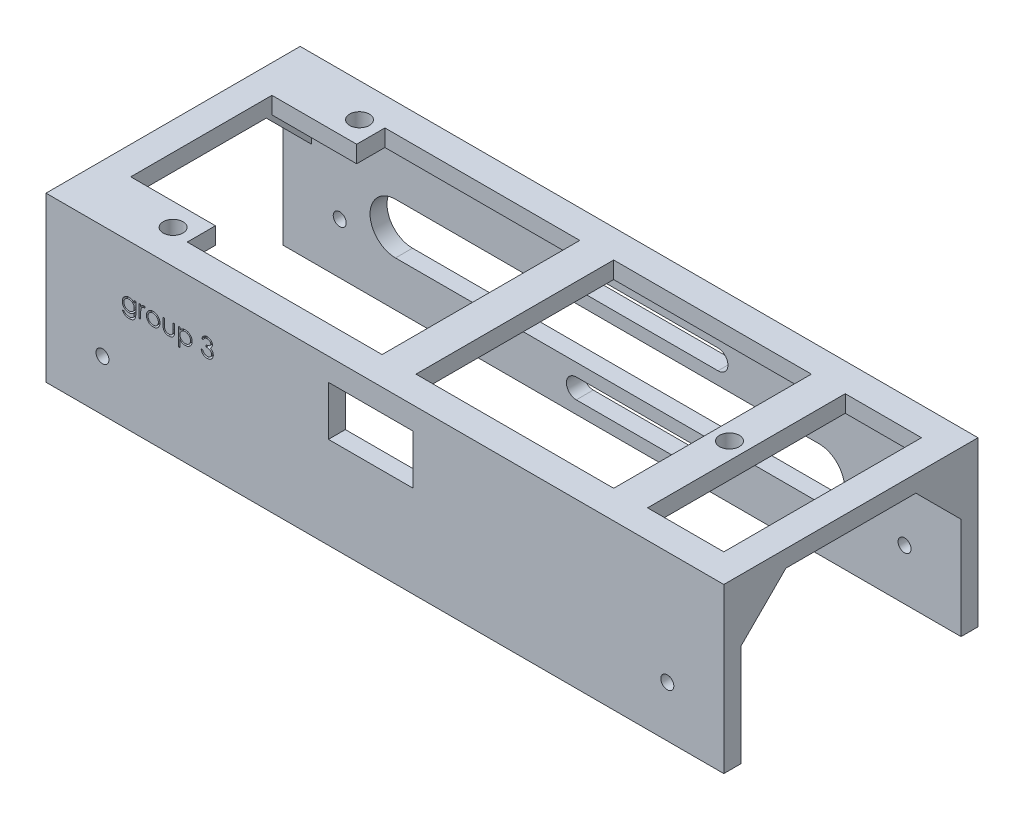
from build123d import *

# Parameters (mm, degrees)
SKETCH1_W           = 120
SKETCH1_H           = 29
BOSS_EXTRUDE5_DEPTH = 45
SHELL9_T            = -3
SKETCH3_R           = 1.15
CUT_EXTRUDE2_DEPTH  = 79
CUT_EXTRUDE8_DEPTH  = 23
SKETCH7_W           = 15
SKETCH7_H           = 8.75
CUT_EXTRUDE9_DEPTH  = 20
SKETCH13_W          = 110
SKETCH13_H          = 35
CUT_EXTRUDE14_DEPTH = 10
SKETCH17_W          = 15
SKETCH17_H          = 5
SKETCH17_W_2        = 6
SKETCH17_H_2        = 35
BOSS_EXTRUDE6_DEPTH = 3
SKETCH17_4_R        = 1.75
CUT_EXTRUDE16_DEPTH = 10
CUT_EXTRUDE15_DEPTH = 1.5
BOSS_EXTRUDE7_DEPTH = 5
BOSS_EXTRUDE8_DEPTH = 5


with BuildPart() as part:
    # Sketch1 → Boss-Extrude5 (new body)
    with BuildSketch(Plane.XY):
        with Locations((60, 14.5)):
            Rectangle(SKETCH1_W, SKETCH1_H)
    extrude(amount=BOSS_EXTRUDE5_DEPTH)

    # Shell9
    shell9_openings = [part.faces().sort_by_distance(p)[0] for p in [
        (120, 14.5, 22.5),
        (60, 0, 22.5),
        (0, 14.5, 22.5),
    ]]
    offset(amount=SHELL9_T, openings=shell9_openings, kind=Kind.INTERSECTION)

    # Sketch3 → Cut-Extrude2 (cut)
    with BuildSketch(Plane(origin=(0, 0, 0), x_dir=(-1, 0, 0), z_dir=(0, 0, -1))):
        with Locations((-10, 9)):
            Circle(SKETCH3_R)
        with Locations((-110, 9)):
            Circle(SKETCH3_R)
    extrude(amount=-CUT_EXTRUDE2_DEPTH, mode=Mode.SUBTRACT)

    # Sketch6 → Cut-Extrude8 (cut)
    with BuildSketch(Plane(origin=(0, 0, 0), x_dir=(-1, 0, 0), z_dir=(0, 0, -1))):
        with BuildLine():
            Line((-51.883496676, 22.75), (-76.973496676, 22.75))
            ThreePointArc((-76.973496676, 22.75), (-78.723496676, 21), (-76.973496676, 19.25))
            Line((-76.973496676, 19.25), (-51.883496676, 19.25))
            ThreePointArc((-51.883496676, 19.25), (-50.133496676, 21), (-51.883496676, 22.75))
        make_face()
        with BuildLine():
            Line((-19.873496676, 17), (-94.873496676, 17))
            ThreePointArc((-94.873496676, 17), (-99.373496676, 12.5), (-94.873496676, 8))
            Line((-94.873496676, 8), (-19.873496676, 8))
            ThreePointArc((-19.873496676, 8), (-15.373496676, 12.5), (-19.873496676, 17))
        make_face()
        with BuildLine():
            ThreePointArc((-76.973496676, 5.75), (-78.723496676, 4), (-76.973496676, 2.25))
            Line((-76.973496676, 2.25), (-51.883496676, 2.25))
            ThreePointArc((-51.883496676, 2.25), (-50.133496676, 4), (-51.883496676, 5.75))
            Line((-51.883496676, 5.75), (-76.973496676, 5.75))
        make_face()
    extrude(amount=-CUT_EXTRUDE8_DEPTH, mode=Mode.SUBTRACT)

    # Sketch7 → Cut-Extrude9 (cut)
    with BuildSketch(Plane.XY.offset(45)):
        with Locations((57.5, 20.625)):
            Rectangle(SKETCH7_W, SKETCH7_H)
    extrude(amount=-CUT_EXTRUDE9_DEPTH, mode=Mode.SUBTRACT)

    # Sketch13 → Cut-Extrude14 (cut)
    with BuildSketch(Plane(origin=(0, 29, 0), x_dir=(1, 0, 0), z_dir=(0, 1, 0))):
        with Locations((60, -22.5)):
            Rectangle(SKETCH13_W, SKETCH13_H)
    extrude(amount=-CUT_EXTRUDE14_DEPTH, mode=Mode.SUBTRACT)

    # Sketch17 → Boss-Extrude6 (add)
    with BuildSketch(Plane(origin=(0, 29, 0), x_dir=(1, 0, 0), z_dir=(0, 1, 0))):
        with Locations((12.5, -7.5)):
            Rectangle(SKETCH17_W, SKETCH17_H)
        with Locations((12.5, -37.5)):
            Rectangle(SKETCH17_W, SKETCH17_H)
        with Locations((57.5, -22.5)):
            Rectangle(SKETCH17_W_2, SKETCH17_H_2)
        with Locations((98.5, -22.5)):
            Rectangle(SKETCH17_W_2, SKETCH17_H_2)
    extrude(amount=-BOSS_EXTRUDE6_DEPTH)

    # Sketch17<4> → Cut-Extrude16 (cut)
    with BuildSketch(Plane(origin=(0, 29, 0), x_dir=(1, 0, 0), z_dir=(0, 1, 0))):
        with Locations((98.5, -22.5)):
            Circle(SKETCH17_4_R)
        with Locations((16.5, -6)):
            Circle(SKETCH17_4_R)
        with Locations((16.5, -39)):
            Circle(SKETCH17_4_R)
    extrude(amount=-CUT_EXTRUDE16_DEPTH, mode=Mode.SUBTRACT)

    # Sketch20 → Cut-Extrude15 (cut)
    # profile 1 of 6: a face of its own
    with BuildSketch(Plane.XY.offset(45)):
        with BuildLine():
            Line((15.616704574, 20.332761713), (15.901640472, 20.332761713))
            Line((15.901640472, 20.332761713), (15.901640472, 18.49149068))
            add(Edge.make_bspline(
                [(15.901640472, 18.49149068), (15.901389155, 18.452268005), (15.900904052, 18.376558794), (15.897410671, 18.267086354), (15.890044057, 18.165970691), (15.881690467, 18.072750642), (15.869673803, 17.9878583), (15.854999527, 17.91104035), (15.838457161, 17.842223075), (15.823924535, 17.799836969), (15.817050127, 17.779786954)],
                knots=[0, 0, 0, 0, 1.307562039, 2.523909702, 3.650326591, 4.686913197, 5.643429486, 6.506965704, 7.293745905, 8, 8, 8, 8], degree=3))
            add(Edge.make_bspline(
                [(15.817050127, 17.779786954), (15.806899889, 17.753724811), (15.786902899, 17.702379766), (15.749450931, 17.629595775), (15.707510176, 17.561064407), (15.659606909, 17.497167576), (15.605957751, 17.438226048), (15.547826683, 17.382959277), (15.484081581, 17.332536497), (15.414758892, 17.287827692), (15.341456639, 17.247562292), (15.264216961, 17.212685764), (15.183475406, 17.182308413), (15.098473497, 17.159554734), (15.010543928, 17.139838237), (14.918652687, 17.127006986), (14.823336649, 17.118273869), (14.758525483, 17.117466301), (14.725643877, 17.117056585)],
                knots=[0, 0, 0, 0, 0.981931301, 1.934503488, 2.87077864, 3.801706999, 4.735015492, 5.667491629, 6.616593066, 7.585388521, 8.561939025, 9.551802639, 10.560317337, 11.588439944, 12.640189604, 13.723962949, 14.845264515, 16, 16, 16, 16], degree=3))
            add(Edge.make_bspline(
                [(14.725643877, 17.117056585), (14.677669868, 17.11783354), (14.583963739, 17.119351142), (14.447343495, 17.137032186), (14.317590571, 17.162027939), (14.196419457, 17.19986072), (14.084595869, 17.246158561), (13.982883496, 17.299312554), (13.89219542, 17.360262855), (13.810440374, 17.429659829), (13.736651931, 17.512176883), (13.667230747, 17.609421549), (13.600409749, 17.722875084), (13.561249628, 17.806144188), (13.540743036, 17.849748893)],
                knots=[0, 0, 0, 0, 1.157897085, 2.2616841, 3.32207898, 4.345638746, 5.321241055, 6.241986252, 7.112515963, 7.955008012, 8.825025602, 9.77857164, 10.836726669, 12, 12, 12, 12], degree=3))
            Line((13.540743036, 17.849748893), (13.825678933, 17.849748893))
            add(Edge.make_bspline(
                [(13.825678933, 17.849748893), (13.848595366, 17.813367134), (13.89339417, 17.742245276), (13.977167435, 17.650158342), (14.068976031, 17.571460647), (14.171918315, 17.508041587), (14.286422618, 17.460226276), (14.412557826, 17.426140115), (14.55135034, 17.405732787), (14.647977577, 17.403273256), (14.698295119, 17.401992483)],
                knots=[0, 0, 0, 0, 0.997731894, 1.950442991, 2.880492273, 3.800895997, 4.748200782, 5.754801363, 6.83083817, 8, 8, 8, 8], degree=3))
            add(Edge.make_bspline(
                [(14.698295119, 17.401992483), (14.747976513, 17.403289832), (14.843757266, 17.405790991), (14.981489827, 17.426149222), (15.107215235, 17.460233694), (15.220209131, 17.507957016), (15.319138293, 17.566422742), (15.404420599, 17.631737095), (15.473494698, 17.705379862), (15.519952175, 17.773217644), (15.548830721, 17.833655247), (15.567220536, 17.885682245), (15.582164779, 17.944513069), (15.594665061, 18.009950487), (15.604980103, 18.08208799), (15.611514147, 18.161090521), (15.616236561, 18.246778529), (15.616544963, 18.306190162), (15.616704574, 18.336938396)],
                knots=[0, 0, 0, 0, 1.570740765, 3.028230971, 4.391408896, 5.680370741, 6.894727393, 8.017376726, 9.065722033, 10.075533815, 10.603371122, 11.180248986, 11.817768598, 12.521299649, 13.286540596, 14.121245857, 15.027658897, 16, 16, 16, 16], degree=3))
            Line((15.616704574, 18.336938396), (15.616704574, 18.457145728))
            add(Edge.make_bspline(
                [(15.616704574, 18.457145728), (15.587783846, 18.422727093), (15.530451097, 18.354495237), (15.431438879, 18.265085752), (15.323292106, 18.188081905), (15.206194892, 18.124927858), (15.083015558, 18.074416852), (14.955088249, 18.039090023), (14.823559742, 18.016266399), (14.734431006, 18.013810477), (14.689390872, 18.012569406)],
                knots=[0, 0, 0, 0, 1.012485704, 2.007162095, 2.997754123, 3.998611389, 4.999708251, 5.992315798, 6.98544096, 8, 8, 8, 8], degree=3))
            add(Edge.make_bspline(
                [(14.689390872, 18.012569406), (14.662869399, 18.013036608), (14.610140308, 18.013965485), (14.531804216, 18.022092376), (14.454624104, 18.033884092), (14.378779973, 18.051193683), (14.304162381, 18.073411178), (14.230894637, 18.101184934), (14.158383509, 18.132585791), (14.087947043, 18.169572548), (14.020286767, 18.210722641), (13.955913021, 18.255298635), (13.895162989, 18.303067225), (13.838614888, 18.354499449), (13.786342893, 18.409520868), (13.737643956, 18.467544948), (13.693323362, 18.52938192), (13.652471645, 18.593904232), (13.617040867, 18.661541641), (13.585940044, 18.730827485), (13.558898655, 18.801613615), (13.537340041, 18.874137022), (13.520874388, 18.948351984), (13.508618682, 19.02413692), (13.501667308, 19.1017252), (13.500583341, 19.153995995), (13.500037908, 19.180297771)],
                knots=[0, 0, 0, 0, 1.028754217, 2.045334182, 3.052854819, 4.056607503, 5.061168794, 6.071104265, 7.095078842, 8.125279047, 9.155117945, 10.165957491, 11.161587969, 12.151493252, 13.128948131, 14.104219989, 15.088194871, 16.07871515, 17.064853787, 18.047899887, 19.02414258, 20.002704429, 20.980574569, 21.971845993, 22.979467364, 24, 24, 24, 24], degree=3))
            add(Edge.make_bspline(
                [(13.500037908, 19.180297771), (13.500508866, 19.206607723), (13.501448958, 19.259125723), (13.509568775, 19.337030594), (13.521151346, 19.413892296), (13.53948268, 19.488918582), (13.561546682, 19.562963892), (13.588873066, 19.635481306), (13.621728655, 19.706492911), (13.658930356, 19.776051293), (13.700735212, 19.843223058), (13.746575391, 19.907019373), (13.796506234, 19.966970786), (13.8498389, 20.023682111), (13.907224591, 20.07660618), (13.96863362, 20.125614541), (14.033460661, 20.171528693), (14.101906631, 20.213358264), (14.172915405, 20.250353587), (14.24468294, 20.284110729), (14.31815991, 20.310902394), (14.391976428, 20.334509063), (14.467432493, 20.351232418), (14.543602915, 20.364134024), (14.620748464, 20.371994163), (14.672412876, 20.372975315), (14.698295119, 20.373466842)],
                knots=[0, 0, 0, 0, 1.008818848, 2.013730394, 3.001654427, 3.987803273, 4.973046549, 5.963777569, 6.957074694, 7.972068341, 8.987420212, 9.989399531, 10.982630087, 11.977756091, 12.973280677, 13.973972381, 14.989194003, 16.018387222, 17.047741039, 18.059210846, 19.057554164, 20.045176975, 21.029480261, 22.018708529, 23.007435371, 24, 24, 24, 24], degree=3))
            add(Edge.make_bspline(
                [(14.698295119, 20.373466842), (14.740977042, 20.372236145), (14.825260726, 20.369805898), (14.949295278, 20.350736716), (15.068985739, 20.320334718), (15.18500751, 20.276777682), (15.298305708, 20.217314433), (15.408506924, 20.138989044), (15.515929996, 20.04109895), (15.582222028, 19.966030281), (15.616704574, 19.926982467)],
                knots=[0, 0, 0, 0, 0.96728863, 1.910097829, 2.838038873, 3.762875196, 4.71315279, 5.730631239, 6.819562287, 8, 8, 8, 8], degree=3))
            Line((15.616704574, 19.926982467), (15.616704574, 20.332761713))
        make_face()
        with BuildLine():
            add(Edge.make_bspline(
                [(14.721191754, 20.088530944), (14.679526044, 20.087114835), (14.597036773, 20.084311238), (14.476125205, 20.060376534), (14.359396844, 20.022869897), (14.249083349, 19.969219095), (14.145753328, 19.903819322), (14.054064026, 19.824589204), (13.973868138, 19.734105154), (13.90602933, 19.633185287), (13.852025876, 19.524307938), (13.813795774, 19.409544629), (13.78907611, 19.290749742), (13.78634774, 19.209676024), (13.784973805, 19.168849454)],
                knots=[0, 0, 0, 0, 1.026226791, 2.031711442, 3.026614839, 4.04107745, 5.047145931, 6.032893242, 7.017642609, 8.019221815, 9.021877557, 10.003543541, 10.994637589, 12, 12, 12, 12], degree=3))
            add(Edge.make_bspline(
                [(13.784973805, 19.168849454), (13.78563217, 19.138067128), (13.786926982, 19.077527295), (13.799376227, 18.988683633), (13.819497532, 18.904065063), (13.848015569, 18.823666466), (13.883351228, 18.747026688), (13.927794307, 18.674673668), (13.980091974, 18.60654297), (14.039834895, 18.543138509), (14.105672041, 18.485388916), (14.177081601, 18.434645122), (14.25396672, 18.393142682), (14.334436469, 18.357273494), (14.42044337, 18.331076054), (14.510748612, 18.311083733), (14.605991079, 18.299645788), (14.670916871, 18.298228108), (14.704019278, 18.297505303)],
                knots=[0, 0, 0, 0, 1.039728707, 2.044842319, 3.024901384, 3.974314358, 4.923051295, 5.871625912, 6.837440708, 7.820715446, 8.810779094, 9.792721783, 10.773906224, 11.758876063, 12.764959493, 13.806266761, 14.881525401, 16, 16, 16, 16], degree=3))
            add(Edge.make_bspline(
                [(14.704019278, 18.297505303), (14.737550687, 18.298201634), (14.803121003, 18.299563302), (14.898888923, 18.311268619), (14.989632909, 18.330157126), (15.075269755, 18.356975013), (15.1561228, 18.39119403), (15.231283772, 18.434497961), (15.302364264, 18.483814268), (15.367094722, 18.541338023), (15.425627358, 18.604733697), (15.476636696, 18.673717281), (15.520101946, 18.747250752), (15.556095261, 18.825325821), (15.583573711, 18.908549241), (15.60200586, 18.996712964), (15.614893407, 19.089394606), (15.616091675, 19.152902422), (15.616704574, 19.185385912)],
                knots=[0, 0, 0, 0, 1.121943988, 2.193949579, 3.223793937, 4.220241907, 5.192961521, 6.155822191, 7.11847367, 8.083710714, 9.04790392, 10.001595906, 10.949595423, 11.902125208, 12.873731292, 13.87582262, 14.913508608, 16, 16, 16, 16], degree=3))
            add(Edge.make_bspline(
                [(15.616704574, 19.185385912), (15.615489395, 19.227674965), (15.613115361, 19.310292915), (15.59071151, 19.430676912), (15.554588891, 19.543859923), (15.503927909, 19.649483987), (15.440444229, 19.746429935), (15.363980388, 19.83290228), (15.27585506, 19.909012343), (15.176321441, 19.97241999), (15.069235544, 20.023642205), (14.957184173, 20.062070384), (14.840333683, 20.083836656), (14.761134297, 20.086957176), (14.721191754, 20.088530944)],
                knots=[0, 0, 0, 0, 1.070913519, 2.092188694, 3.091357305, 4.074328408, 5.051968682, 6.018948707, 6.99050112, 7.9935919, 9.000589572, 9.992915277, 10.987769056, 12, 12, 12, 12], degree=3))
        make_face(mode=Mode.SUBTRACT)
    # profile 2 of 6: a face of its own
    with BuildSketch(Plane.XY.offset(45)):
        with BuildLine():
            Line((16.471512267, 20.332761713), (16.756448164, 20.332761713))
            Line((16.756448164, 20.332761713), (16.756448164, 19.991220247))
            add(Edge.make_bspline(
                [(16.756448164, 19.991220247), (16.777483681, 20.023020891), (16.817713944, 20.083839376), (16.884582101, 20.1642751), (16.953074409, 20.230873035), (17.023518757, 20.283944084), (17.096433176, 20.323688842), (17.170217411, 20.352801809), (17.246032302, 20.370016945), (17.29697919, 20.372315336), (17.322503853, 20.373466842)],
                knots=[0, 0, 0, 0, 1.2804753, 2.448899062, 3.506932113, 4.484331642, 5.4025378, 6.288909075, 7.142734305, 8, 8, 8, 8], degree=3))
            add(Edge.make_bspline(
                [(17.322503853, 20.373466842), (17.342303449, 20.372386864), (17.383042405, 20.37016474), (17.444712326, 20.354552063), (17.508251743, 20.329625571), (17.549202337, 20.306184798), (17.570550728, 20.293964638)],
                knots=[0, 0, 0, 0, 0.901110191, 1.854092781, 2.881294221, 4, 4, 4, 4], degree=3))
            Line((17.570550728, 20.293964638), (17.414090392, 20.047189798))
            add(Edge.make_bspline(
                [(17.414090392, 20.047189798), (17.400384351, 20.053304183), (17.374367662, 20.064910455), (17.336308877, 20.078646421), (17.301219379, 20.08673443), (17.278864151, 20.087959724), (17.268442355, 20.088530944)],
                knots=[0, 0, 0, 0, 1.180555205, 2.24091978, 3.179933427, 4, 4, 4, 4], degree=3))
            add(Edge.make_bspline(
                [(17.268442355, 20.088530944), (17.245577154, 20.08700691), (17.198938771, 20.083898323), (17.130463547, 20.059460976), (17.064017868, 20.019977365), (17.01124786, 19.976188571), (16.970388102, 19.933963069), (16.941232326, 19.897089161), (16.914487262, 19.855742831), (16.888932848, 19.810630903), (16.865649853, 19.760983115), (16.843919546, 19.707295485), (16.824271863, 19.649505833), (16.813068427, 19.609244546), (16.807329574, 19.588621088)],
                knots=[0, 0, 0, 0, 1.125678352, 2.296057538, 3.5422874, 4.923748041, 5.663163013, 6.437101912, 7.23742474, 8.08941207, 8.991984279, 9.93940061, 10.944477711, 12, 12, 12, 12], degree=3))
            add(Edge.make_bspline(
                [(16.807329574, 19.588621088), (16.803036618, 19.570226795), (16.793528044, 19.529484834), (16.784282864, 19.461132958), (16.775148372, 19.380375782), (16.768710726, 19.286988515), (16.762743502, 19.18120437), (16.759377927, 19.06286219), (16.756562935, 18.931840507), (16.756487582, 18.840242344), (16.756448164, 18.792327018)],
                knots=[0, 0, 0, 0, 0.566838948, 1.255505196, 2.06880316, 3.007127437, 4.065329342, 5.249902469, 6.561414163, 8, 8, 8, 8], degree=3))
            Line((16.756448164, 18.792327018), (16.756448164, 18.012569406))
            Line((16.756448164, 18.012569406), (16.471512267, 18.012569406))
            Line((16.471512267, 18.012569406), (16.471512267, 20.332761713))
        make_face()
    # profile 3 of 6: a face of its own
    with BuildSketch(Plane.XY.offset(45)):
        with BuildLine():
            add(Edge.make_bspline(
                [(18.976149687, 20.373466842), (19.019684627, 20.37253984), (19.105046006, 20.370722218), (19.230057445, 20.351295784), (19.349387675, 20.321589247), (19.463493721, 20.280521473), (19.570914218, 20.225474275), (19.673213846, 20.159788703), (19.770112133, 20.081971636), (19.828190167, 20.021775389), (19.857670119, 19.991220247)],
                knots=[0, 0, 0, 0, 1.054011418, 2.066658804, 3.057071809, 4.030435133, 4.997543892, 5.974964718, 6.972108034, 8, 8, 8, 8], degree=3))
            add(Edge.make_bspline(
                [(19.857670119, 19.991220247), (19.883053749, 19.96199756), (19.933329765, 19.904117725), (19.997796525, 19.810268705), (20.053333226, 19.713077328), (20.09784034, 19.611252967), (20.132933183, 19.505684516), (20.157848493, 19.39600912), (20.172668427, 19.282468991), (20.174666833, 19.205358366), (20.175678933, 19.166305383)],
                knots=[0, 0, 0, 0, 1.025258237, 2.030674902, 3.01204498, 3.988269485, 4.97094183, 5.956517959, 6.965070386, 8, 8, 8, 8], degree=3))
            add(Edge.make_bspline(
                [(20.175678933, 19.166305383), (20.17478872, 19.127026045), (20.173029618, 19.049408242), (20.156389337, 18.935090674), (20.130507566, 18.824242513), (20.093467256, 18.717327841), (20.045970971, 18.614019848), (19.98801299, 18.514769757), (19.919186595, 18.41938175), (19.841168683, 18.328665797), (19.754943053, 18.245057873), (19.661401975, 18.172188657), (19.562383673, 18.109757703), (19.456571489, 18.059468955), (19.344931697, 18.019818012), (19.227223499, 17.991968712), (19.103629757, 17.975130613), (19.019240778, 17.972968371), (18.976149687, 17.971864278)],
                knots=[0, 0, 0, 0, 0.998656419, 1.973391657, 2.932242238, 3.890759089, 4.846373663, 5.82037756, 6.809684879, 7.83454468, 8.860553229, 9.859544525, 10.845671541, 11.83227036, 12.833544569, 13.85385346, 14.904124723, 16, 16, 16, 16], degree=3))
            add(Edge.make_bspline(
                [(18.976149687, 17.971864278), (18.932847477, 17.972972077), (18.848037911, 17.975141758), (18.724007913, 17.991903293), (18.606088759, 18.019805177), (18.494302816, 18.05959926), (18.388035705, 18.10975931), (18.288443668, 18.171999915), (18.194826602, 18.245079484), (18.10858273, 18.328659941), (18.03056971, 18.419383259), (17.961742052, 18.514769365), (17.903784399, 18.61401995), (17.856288029, 18.717327814), (17.819247741, 18.824242521), (17.793365964, 18.935090672), (17.776725685, 19.049408242), (17.774966583, 19.127026045), (17.774076369, 19.166305383)],
                knots=[0, 0, 0, 0, 1.099876186, 2.154163076, 3.173186993, 4.173200201, 5.163417411, 6.152872554, 7.150605724, 8.17532212, 9.198891216, 10.186952605, 11.159729845, 12.11414092, 13.071450619, 14.029093627, 15.002601286, 16, 16, 16, 16], degree=3))
            add(Edge.make_bspline(
                [(17.774076369, 19.166305383), (17.775095372, 19.205146107), (17.777112823, 19.282044065), (17.791917856, 19.395370756), (17.816735975, 19.50486053), (17.851870885, 19.610021498), (17.896788237, 19.711399643), (17.951544548, 19.808831168), (18.016668907, 19.902255816), (18.066744963, 19.960060846), (18.092085183, 19.989312194)],
                knots=[0, 0, 0, 0, 1.031353054, 2.041901799, 3.029428768, 4.008703097, 4.981709435, 5.96992636, 6.972712378, 8, 8, 8, 8], degree=3))
            add(Edge.make_bspline(
                [(18.092085183, 19.989312194), (18.121520691, 20.020132318), (18.179410796, 20.080745514), (18.276791428, 20.158335732), (18.378839394, 20.22538817), (18.487447005, 20.279341594), (18.601459312, 20.321830821), (18.721401054, 20.351372396), (18.8468367, 20.370652225), (18.932615785, 20.372519286), (18.976149687, 20.373466842)],
                knots=[0, 0, 0, 0, 1.027980169, 2.021703884, 2.998553061, 3.971491411, 4.943284454, 5.930300938, 6.949603206, 8, 8, 8, 8], degree=3))
        make_face()
        with BuildLine():
            add(Edge.make_bspline(
                [(18.974877651, 20.088530944), (18.94409139, 20.087655922), (18.883313609, 20.085928465), (18.793851557, 20.072789495), (18.707727274, 20.05197283), (18.624777366, 20.022396294), (18.545281559, 19.984206578), (18.469163744, 19.937299709), (18.396200031, 19.882296955), (18.327817731, 19.819284389), (18.26505949, 19.750451301), (18.210197326, 19.67711029), (18.163547408, 19.600450961), (18.124685264, 19.520393598), (18.095740886, 19.436126908), (18.074719644, 19.348605193), (18.061593069, 19.257650137), (18.059881854, 19.195818356), (18.059012267, 19.16439733)],
                knots=[0, 0, 0, 0, 1.021534396, 2.016698045, 2.994645724, 3.958388632, 4.93408049, 5.916473867, 6.921342795, 7.962252576, 8.998418191, 10.008913653, 10.997312074, 11.973003931, 12.956656626, 13.948281152, 14.957379055, 16, 16, 16, 16], degree=3))
            add(Edge.make_bspline(
                [(18.059012267, 19.16439733), (18.060469885, 19.123800849), (18.063362986, 19.043224424), (18.08688995, 18.924560048), (18.126247504, 18.810639368), (18.179394536, 18.702130218), (18.245984463, 18.601734651), (18.324440588, 18.512225519), (18.413920888, 18.434949819), (18.513358713, 18.370832194), (18.620722987, 18.319887273), (18.734348364, 18.283783917), (18.852858136, 18.260314596), (18.933848514, 18.257981901), (18.974877651, 18.256800175)],
                knots=[0, 0, 0, 0, 1.016792936, 2.018143844, 3.017858371, 4.030088057, 5.03801393, 6.028138512, 7.003788237, 7.991172063, 8.984598303, 9.972568034, 10.972917682, 12, 12, 12, 12], degree=3))
            add(Edge.make_bspline(
                [(18.974877651, 18.256800175), (19.015904429, 18.257988786), (19.096890148, 18.260335072), (19.215235258, 18.283665716), (19.328550076, 18.320045465), (19.435802834, 18.370774898), (19.535195396, 18.435193303), (19.625319242, 18.51178916), (19.703105482, 18.601971725), (19.769629538, 18.702263197), (19.82364694, 18.810471145), (19.862820273, 18.924581074), (19.886403798, 19.043219069), (19.889289264, 19.123799055), (19.890743036, 19.16439733)],
                knots=[0, 0, 0, 0, 1.02726834, 2.027799167, 3.010890988, 4.004497153, 4.992059811, 5.971914811, 6.958719428, 7.966827853, 8.981595046, 9.981490638, 10.983022906, 12, 12, 12, 12], degree=3))
            add(Edge.make_bspline(
                [(19.890743036, 19.16439733), (19.889873748, 19.195818544), (19.888163122, 19.257650694), (19.875032262, 19.348603063), (19.854026879, 19.436134725), (19.825024055, 19.520364757), (19.786330771, 19.600658243), (19.738781252, 19.67688521), (19.684143107, 19.750705362), (19.620627576, 19.819061879), (19.552316655, 19.882321519), (19.47932337, 19.937321037), (19.403318425, 19.984000427), (19.324053568, 20.022722945), (19.241093025, 20.051703747), (19.155089415, 20.072909691), (19.066009066, 20.085872941), (19.005449077, 20.087639276), (18.974877651, 20.088530944)],
                knots=[0, 0, 0, 0, 1.042956736, 2.052379634, 3.044323526, 4.02829302, 5.004299113, 5.996692471, 7.007513377, 8.048758398, 9.090003419, 10.095195979, 11.07790575, 12.047570684, 13.018257071, 13.989683339, 14.985167495, 16, 16, 16, 16], degree=3))
        make_face(mode=Mode.SUBTRACT)
    # profile 4 of 6: a face of its own
    with BuildSketch(Plane.XY.offset(45)):
        with BuildLine():
            Line((20.7048456, 20.332761713), (20.989781497, 20.332761713))
            Line((20.989781497, 20.332761713), (20.989781497, 19.256619887))
            add(Edge.make_bspline(
                [(20.989781497, 19.256619887), (20.989910225, 19.225030678), (20.990156476, 19.164602003), (20.991826473, 19.077647655), (20.995754486, 18.998348208), (21.000665598, 18.926657854), (21.00698125, 18.86258872), (21.014495442, 18.806364589), (21.022894153, 18.757347865), (21.031115329, 18.727826393), (21.034938749, 18.71409685)],
                knots=[0, 0, 0, 0, 1.388932606, 2.656963016, 3.823490214, 4.879454478, 5.816252168, 6.653371382, 7.373723809, 8, 8, 8, 8], degree=3))
            add(Edge.make_bspline(
                [(21.034938749, 18.71409685), (21.041072355, 18.696840388), (21.05321205, 18.662686223), (21.075231567, 18.613347625), (21.102471558, 18.567650048), (21.132280116, 18.523831353), (21.166660293, 18.483189551), (21.205177099, 18.445793272), (21.246541214, 18.410229561), (21.3080047, 18.368151928), (21.392059891, 18.323053022), (21.502416319, 18.284140387), (21.622072295, 18.260885035), (21.704771719, 18.258186961), (21.747278493, 18.256800175)],
                knots=[0, 0, 0, 0, 0.725840625, 1.436591201, 2.137033971, 2.831655856, 3.53531722, 4.242432219, 4.957935707, 5.694543706, 7.190802206, 8.724350549, 10.316345118, 12, 12, 12, 12], degree=3))
            add(Edge.make_bspline(
                [(21.747278493, 18.256800175), (21.789781318, 18.258216451), (21.872016419, 18.260956682), (21.990357713, 18.283438892), (22.098535782, 18.320999767), (22.195464859, 18.373439347), (22.2807053, 18.437612504), (22.351738594, 18.512913352), (22.410346603, 18.596959582), (22.435936578, 18.659665178), (22.448805937, 18.691200215)],
                knots=[0, 0, 0, 0, 1.157059328, 2.238695713, 3.266970494, 4.264342957, 5.228770407, 6.160125903, 7.074715775, 8, 8, 8, 8], degree=3))
            add(Edge.make_bspline(
                [(22.448805937, 18.691200215), (22.452610702, 18.703869643), (22.46102211, 18.731878654), (22.470059386, 18.779394569), (22.478200505, 18.836058889), (22.485152101, 18.902242407), (22.490109784, 18.977772166), (22.492782251, 19.062624564), (22.495801472, 19.156533227), (22.495847297, 19.222271837), (22.495871241, 19.256619887)],
                knots=[0, 0, 0, 0, 0.557542046, 1.232589297, 2.036731608, 2.971723315, 4.038036528, 5.22795436, 6.551621927, 8, 8, 8, 8], degree=3))
            Line((22.495871241, 19.256619887), (22.495871241, 20.332761713))
            Line((22.495871241, 20.332761713), (22.780807138, 20.332761713))
            Line((22.780807138, 20.332761713), (22.780807138, 19.203194406))
            add(Edge.make_bspline(
                [(22.780807138, 19.203194406), (22.780406458, 19.164815757), (22.779629084, 19.09035593), (22.774633136, 18.9821482), (22.766060988, 18.881308163), (22.753050123, 18.787782443), (22.737750547, 18.701642441), (22.7180145, 18.622777758), (22.694448527, 18.551431377), (22.667864238, 18.486351337), (22.636457258, 18.427344511), (22.60304989, 18.371341306), (22.564473847, 18.319731286), (22.523860848, 18.269945348), (22.478683632, 18.224459819), (22.42978876, 18.18223098), (22.377864429, 18.142613302), (22.321758371, 18.107151927), (22.262289657, 18.075205398), (22.199384872, 18.046887956), (22.132273538, 18.02447919), (22.061821525, 18.005147372), (21.98768366, 17.98998496), (21.909931418, 17.97929286), (21.828590988, 17.972738453), (21.773155978, 17.972160562), (21.744734422, 17.971864278)],
                knots=[0, 0, 0, 0, 1.493040784, 2.896703357, 4.213163133, 5.428574705, 6.569057535, 7.615249723, 8.588095153, 9.490268104, 10.346124644, 11.18633936, 12.024365274, 12.850166724, 13.684164916, 14.514361689, 15.362232829, 16.222528818, 17.093394965, 17.986930858, 18.902426812, 19.842810585, 20.827885679, 21.843828298, 22.894529745, 24, 24, 24, 24], degree=3))
            add(Edge.make_bspline(
                [(21.744734422, 17.971864278), (21.716525441, 17.97217244), (21.661092168, 17.972778009), (21.57974754, 17.979256649), (21.501779875, 17.989968347), (21.427466371, 18.005258437), (21.356732454, 18.024343879), (21.289291607, 18.047025657), (21.225933518, 18.075220094), (21.165896986, 18.106949736), (21.109651962, 18.142841093), (21.056939181, 18.1821821), (21.007829322, 18.224914029), (20.962311553, 18.270858417), (20.921024781, 18.320585209), (20.883454515, 18.373694396), (20.849022361, 18.429659748), (20.817859472, 18.489588474), (20.791088094, 18.555421654), (20.767452264, 18.628262592), (20.748120471, 18.708909875), (20.732388374, 18.797294553), (20.719732425, 18.892993627), (20.71094571, 18.996560689), (20.706032778, 19.107743467), (20.705249858, 19.18453301), (20.7048456, 19.224182988)],
                knots=[0, 0, 0, 0, 1.083640291, 2.129454052, 3.13281866, 4.105697902, 5.042300162, 5.946461698, 6.836384745, 7.703652036, 8.553297018, 9.397182691, 10.228592656, 11.052265423, 11.879314572, 12.708807002, 13.549817954, 14.402308542, 15.300838682, 16.27712199, 17.341985831, 18.484375296, 19.725102775, 21.0496083, 22.476576903, 24, 24, 24, 24], degree=3))
            Line((20.7048456, 19.224182988), (20.7048456, 20.332761713))
        make_face()
    # profile 5 of 6: a face of its own
    with BuildSketch(Plane.XY.offset(45)):
        with BuildLine():
            Line((23.43208919, 20.332761713), (23.717025087, 20.332761713))
            Line((23.717025087, 20.332761713), (23.717025087, 19.903449814))
            add(Edge.make_bspline(
                [(23.717025087, 19.903449814), (23.747285091, 19.942400473), (23.806089351, 20.018093283), (23.907439801, 20.116055757), (24.014416263, 20.198674068), (24.129771645, 20.263428223), (24.251713135, 20.312251388), (24.379740309, 20.348337032), (24.51493976, 20.369601798), (24.607374399, 20.372161448), (24.654515071, 20.373466842)],
                knots=[0, 0, 0, 0, 1.0828784, 2.104357462, 3.088488658, 4.04616522, 5.001424249, 5.969181776, 6.964304535, 8, 8, 8, 8], degree=3))
            add(Edge.make_bspline(
                [(24.654515071, 20.373466842), (24.69569174, 20.372275601), (24.777079588, 20.369921051), (24.896879803, 20.35397978), (25.012246044, 20.32665873), (25.122525636, 20.2872879), (25.228899988, 20.238614724), (25.329794321, 20.177185698), (25.42678019, 20.106060082), (25.517418447, 20.024206631), (25.601167116, 19.935643847), (25.673599009, 19.840373614), (25.736075665, 19.741528982), (25.786576577, 19.637577584), (25.826135578, 19.529337997), (25.854270321, 19.416372911), (25.87101404, 19.299101165), (25.873260536, 19.21936084), (25.874396882, 19.179025736)],
                knots=[0, 0, 0, 0, 1.041296284, 2.058176809, 3.050446431, 4.034000596, 5.01514041, 6.003636468, 7.015969324, 8.052561599, 9.08815499, 10.094063707, 11.074456064, 12.040834395, 13.011057502, 13.983766392, 14.980127149, 16, 16, 16, 16], degree=3))
            add(Edge.make_bspline(
                [(25.874396882, 19.179025736), (25.873285192, 19.137839356), (25.871092778, 19.056613871), (25.854088379, 18.93733629), (25.826913215, 18.822594172), (25.787853292, 18.712578369), (25.737378513, 18.607364628), (25.675960805, 18.507028826), (25.603492367, 18.41160311), (25.520669201, 18.322382979), (25.430814037, 18.240196459), (25.334768029, 18.16831621), (25.234021718, 18.107953677), (25.129090538, 18.057531992), (25.019076209, 18.019529797), (24.904492021, 17.992117935), (24.785400359, 17.975213785), (24.704391457, 17.972989342), (24.663419318, 17.971864278)],
                knots=[0, 0, 0, 0, 1.038740735, 2.04854663, 3.033179607, 4.009277356, 4.987731542, 5.972001279, 6.972200261, 8.005528982, 9.039189865, 10.040446548, 11.026516639, 11.997840187, 12.972163198, 13.956796175, 14.96660207, 16, 16, 16, 16], degree=3))
            add(Edge.make_bspline(
                [(24.663419318, 17.971864278), (24.617311449, 17.973038853), (24.52623489, 17.975358984), (24.393068432, 17.998871592), (24.264910145, 18.034011526), (24.143179897, 18.085445614), (24.026913381, 18.150991689), (23.916768272, 18.230920233), (23.812159503, 18.325064085), (23.749195845, 18.39648509), (23.717025087, 18.432977058)],
                knots=[0, 0, 0, 0, 1.014726462, 2.004382257, 2.969841629, 3.936926163, 4.907207904, 5.903978561, 6.929055279, 8, 8, 8, 8], degree=3))
            Line((23.717025087, 18.432977058), (23.717025087, 17.157761713))
            Line((23.717025087, 17.157761713), (23.43208919, 17.157761713))
            Line((23.43208919, 17.157761713), (23.43208919, 20.332761713))
        make_face()
        with BuildLine():
            add(Edge.make_bspline(
                [(24.651971001, 20.088530944), (24.619695255, 20.087950139), (24.55615263, 20.086806682), (24.46301426, 20.073223171), (24.373301979, 20.053503935), (24.287919923, 20.023648139), (24.206049721, 19.987000645), (24.128321943, 19.941206249), (24.05479115, 19.887093358), (23.985642343, 19.825698524), (23.923173499, 19.758048629), (23.867871414, 19.685851116), (23.821419073, 19.609197418), (23.782863669, 19.528801553), (23.753523691, 19.44403333), (23.732699574, 19.355375526), (23.719609182, 19.262731101), (23.717895646, 19.199633867), (23.717025087, 19.167577419)],
                knots=[0, 0, 0, 0, 1.05670511, 2.080379991, 3.077984906, 4.06214886, 5.038337365, 6.01289324, 7.01187578, 8.025460281, 9.038092164, 10.024533457, 11.000252242, 11.969694649, 12.940728589, 13.933144304, 14.949937299, 16, 16, 16, 16], degree=3))
            add(Edge.make_bspline(
                [(23.717025087, 19.167577419), (23.718468221, 19.125496774), (23.721295442, 19.043057226), (23.744280055, 18.922603059), (23.78168633, 18.808619057), (23.834780234, 18.702065116), (23.901861248, 18.604109258), (23.982686004, 18.516397065), (24.076523176, 18.439479886), (24.181812699, 18.374690606), (24.294681347, 18.322087146), (24.41241571, 18.284427827), (24.533396709, 18.261230162), (24.615192256, 18.258284834), (24.656423124, 18.256800175)],
                knots=[0, 0, 0, 0, 1.03728447, 2.032128127, 3.01272805, 3.987917167, 4.958271349, 5.931593992, 6.91984656, 7.941419022, 8.973179163, 9.983609215, 10.983593296, 12, 12, 12, 12], degree=3))
            add(Edge.make_bspline(
                [(24.656423124, 18.256800175), (24.696823428, 18.258212031), (24.777010768, 18.261014312), (24.895082778, 18.285269668), (25.009827857, 18.32232194), (25.118848442, 18.376350966), (25.221195463, 18.442563376), (25.313616587, 18.521992835), (25.394358573, 18.614058712), (25.463178381, 18.716573568), (25.518633371, 18.826496952), (25.56029866, 18.940235783), (25.584345723, 19.057389131), (25.587753667, 19.136308485), (25.589460985, 19.175845648)],
                knots=[0, 0, 0, 0, 1.00104056, 1.986885549, 2.97790532, 3.984399681, 4.995088187, 5.994304198, 6.996462723, 8.023150851, 9.048424203, 10.043036403, 11.019596776, 12, 12, 12, 12], degree=3))
            add(Edge.make_bspline(
                [(25.589460985, 19.175845648), (25.588141333, 19.215628388), (25.585512312, 19.294883921), (25.55961607, 19.411690268), (25.520699662, 19.525888647), (25.463949665, 19.63431086), (25.396638513, 19.736613063), (25.315225166, 19.826922653), (25.223951902, 19.905998906), (25.121726732, 19.971327171), (25.012016489, 20.023293299), (24.896523672, 20.061287742), (24.775834119, 20.08412393), (24.693621889, 20.087049017), (24.651971001, 20.088530944)],
                knots=[0, 0, 0, 0, 0.983928682, 1.960191568, 2.949917689, 3.96440592, 4.982380491, 5.975291189, 6.965713506, 7.964880129, 8.970154049, 9.96478489, 10.968906225, 12, 12, 12, 12], degree=3))
        make_face(mode=Mode.SUBTRACT)
    # profile 6 of 6: a face of its own
    with BuildSketch(Plane.XY.offset(45)):
        with BuildLine():
            Line((27.868948164, 20.454877098), (27.584012267, 20.454877098))
            add(Edge.make_bspline(
                [(27.584012267, 20.454877098), (27.591731645, 20.486837994), (27.606822398, 20.549318932), (27.638298054, 20.638588376), (27.672587378, 20.723064713), (27.71376178, 20.801166151), (27.758673293, 20.874462299), (27.810128904, 20.941290719), (27.865754653, 21.003351052), (27.927281571, 21.058426632), (27.991805428, 21.108299286), (28.060235405, 21.150821659), (28.131194744, 21.187401427), (28.205175086, 21.217536923), (28.282396685, 21.240238648), (28.362161414, 21.256709464), (28.444678304, 21.267405689), (28.50069219, 21.268449596), (28.529134462, 21.268979662)],
                knots=[0, 0, 0, 0, 1.162005537, 2.271625781, 3.343758855, 4.383309926, 5.390229558, 6.379919256, 7.361854164, 8.333198761, 9.295911338, 10.242430842, 11.177959212, 12.116337295, 13.062827104, 14.020064771, 14.994644689, 16, 16, 16, 16], degree=3))
            add(Edge.make_bspline(
                [(28.529134462, 21.268979662), (28.570575235, 21.267728503), (28.652552838, 21.265253477), (28.772987888, 21.242652524), (28.889126502, 21.206888297), (28.999697463, 21.157472844), (29.102402755, 21.096524353), (29.193784868, 21.023984913), (29.27260516, 20.941254118), (29.338730774, 20.849875292), (29.390505951, 20.752216366), (29.428684304, 20.651704794), (29.451926829, 20.548579006), (29.454939049, 20.478949189), (29.456448164, 20.444064798)],
                knots=[0, 0, 0, 0, 1.083050992, 2.142477498, 3.193116406, 4.255571735, 5.30263384, 6.308962982, 7.297363603, 8.282367274, 9.249857812, 10.179914175, 11.08814088, 12, 12, 12, 12], degree=3))
            add(Edge.make_bspline(
                [(29.456448164, 20.444064798), (29.455392621, 20.410494349), (29.453327086, 20.344802189), (29.435788653, 20.248897688), (29.406273615, 20.158508522), (29.365388902, 20.073254182), (29.312464781, 19.99367522), (29.248354549, 19.919592591), (29.172605706, 19.850677711), (29.115202669, 19.811199332), (29.085649887, 19.790874694)],
                knots=[0, 0, 0, 0, 1.024540389, 2.004866551, 2.965041327, 3.920577974, 4.882998113, 5.874504559, 6.905732034, 8, 8, 8, 8], degree=3))
            add(Edge.make_bspline(
                [(29.085649887, 19.790874694), (29.119424407, 19.774565924), (29.1863415, 19.742253534), (29.277555195, 19.678884383), (29.360357267, 19.605717553), (29.406534213, 19.548619575), (29.429735424, 19.519931185)],
                knots=[0, 0, 0, 0, 1.015518401, 2.012035669, 3.001164323, 4, 4, 4, 4], degree=3))
            add(Edge.make_bspline(
                [(29.429735424, 19.519931185), (29.445012927, 19.49901451), (29.475317754, 19.457523686), (29.512724274, 19.390815642), (29.546659685, 19.32336822), (29.573103098, 19.253373616), (29.59358082, 19.181643096), (29.608218507, 19.108053494), (29.617311835, 19.032544717), (29.618614085, 18.981461252), (29.619268677, 18.955783548)],
                knots=[0, 0, 0, 0, 1.025084078, 2.033381695, 3.024893161, 4.013698104, 4.991890475, 5.976764909, 6.982997093, 8, 8, 8, 8], degree=3))
            add(Edge.make_bspline(
                [(29.619268677, 18.955783548), (29.617640797, 18.91132473), (29.614392697, 18.822616317), (29.58536043, 18.691557105), (29.540354133, 18.563445399), (29.476439627, 18.440913224), (29.39854553, 18.326268164), (29.305874243, 18.223691798), (29.199478715, 18.135518778), (29.080819305, 18.0618495), (28.952261624, 18.00295967), (28.814760909, 17.962086133), (28.67029836, 17.935465119), (28.57123174, 17.932610459), (28.520866233, 17.931159149)],
                knots=[0, 0, 0, 0, 0.955779014, 1.907060117, 2.875433937, 3.871313158, 4.872415639, 5.851225146, 6.836215519, 7.83643374, 8.849228613, 9.86973379, 10.916971861, 12, 12, 12, 12], degree=3))
            add(Edge.make_bspline(
                [(28.520866233, 17.931159149), (28.486921582, 17.931946743), (28.420129828, 17.933496464), (28.321937512, 17.944090624), (28.22820997, 17.963439986), (28.138820478, 17.989477984), (28.053689623, 18.022490493), (27.973077185, 18.063601026), (27.89648721, 18.111962174), (27.824642448, 18.168144786), (27.757551461, 18.230992859), (27.696997204, 18.301622104), (27.641970106, 18.378726891), (27.59394357, 18.463202807), (27.550730048, 18.553958147), (27.515187323, 18.652154999), (27.483903986, 18.756915505), (27.469359344, 18.829920312), (27.461896882, 18.867377098)],
                knots=[0, 0, 0, 0, 1.048658725, 2.063410685, 3.046034179, 4.001477787, 4.936774919, 5.862367409, 6.792675028, 7.730719943, 8.675894397, 9.627829632, 10.600096036, 11.597688215, 12.626045268, 13.701542398, 14.82072376, 16, 16, 16, 16], degree=3))
            Line((27.461896882, 18.867377098), (27.74683278, 18.867377098))
            add(Edge.make_bspline(
                [(27.74683278, 18.867377098), (27.754256194, 18.842930493), (27.76869538, 18.795379723), (27.793273779, 18.726944589), (27.821275711, 18.664208355), (27.851315346, 18.606710808), (27.882864365, 18.5538857), (27.918165762, 18.507129862), (27.954604915, 18.464389643), (27.982072614, 18.440309888), (27.995515672, 18.428524935)],
                knots=[0, 0, 0, 0, 1.198163088, 2.33053128, 3.407730985, 4.417276592, 5.372219308, 6.28897303, 7.162600585, 8, 8, 8, 8], degree=3))
            add(Edge.make_bspline(
                [(27.995515672, 18.428524935), (28.013292567, 18.414819517), (28.048791482, 18.387450989), (28.106638378, 18.352524511), (28.16747581, 18.322261295), (28.232621979, 18.299143943), (28.300671092, 18.279569922), (28.372723059, 18.266760594), (28.448142206, 18.257972039), (28.499638677, 18.257196494), (28.525954374, 18.256800175)],
                knots=[0, 0, 0, 0, 0.946170439, 1.889420265, 2.845303464, 3.807233317, 4.801018734, 5.828864929, 6.890507805, 8, 8, 8, 8], degree=3))
            add(Edge.make_bspline(
                [(28.525954374, 18.256800175), (28.55566648, 18.257358889), (28.613765938, 18.258451406), (28.698542846, 18.268498654), (28.779194602, 18.283131244), (28.854825757, 18.305730878), (28.926427002, 18.333653508), (28.992994642, 18.368713133), (29.055402538, 18.409847273), (29.112851356, 18.456600653), (29.164509066, 18.507783009), (29.209992768, 18.561316295), (29.248659425, 18.616974797), (29.279850242, 18.675066521), (29.30447967, 18.735350908), (29.321246573, 18.797997131), (29.332904733, 18.862492508), (29.33385416, 18.906333787), (29.33433278, 18.92843479)],
                knots=[0, 0, 0, 0, 1.217147791, 2.380027433, 3.494444702, 4.572153297, 5.609568379, 6.639424714, 7.649109417, 8.668170816, 9.669597737, 10.625200337, 11.543417969, 12.441394052, 13.322311151, 14.205496177, 15.095365482, 16, 16, 16, 16], degree=3))
            add(Edge.make_bspline(
                [(29.33433278, 18.92843479), (29.332944577, 18.958017934), (29.330175081, 19.017037018), (29.309030869, 19.103866532), (29.274252043, 19.187526342), (29.225563407, 19.266589094), (29.166294568, 19.339864376), (29.097020688, 19.405243507), (29.017166509, 19.459191375), (28.943669914, 19.496464656), (28.878568665, 19.521898289), (28.822856137, 19.538839149), (28.760484076, 19.553184394), (28.692206745, 19.566530526), (28.617509684, 19.577889178), (28.536474216, 19.587361396), (28.449083918, 19.594940612), (28.388585503, 19.598325249), (28.357409703, 19.600069406)],
                knots=[0, 0, 0, 0, 1.07054697, 2.135767047, 3.216561865, 4.33974944, 5.486079747, 6.621378074, 7.775625952, 8.963672916, 9.598146892, 10.304877434, 11.070270905, 11.915000392, 12.823868403, 13.805723172, 14.86925407, 16, 16, 16, 16], degree=3))
            Line((28.357409703, 19.600069406), (28.357409703, 19.925710431))
            add(Edge.make_bspline(
                [(28.357409703, 19.925710431), (28.396690046, 19.926377003), (28.473630589, 19.927682654), (28.586020422, 19.943474206), (28.693492641, 19.965318776), (28.793665471, 19.998778915), (28.884968233, 20.037641184), (28.964179586, 20.08286426), (29.030189784, 20.133133354), (29.082678042, 20.189224364), (29.122165271, 20.249381585), (29.151036723, 20.312080268), (29.168091304, 20.377869952), (29.170367931, 20.422768686), (29.171512267, 20.445336834)],
                knots=[0, 0, 0, 0, 1.321986639, 2.589447074, 3.816329219, 5.01088745, 6.139805852, 7.153945165, 8.075214402, 8.924034688, 9.728124013, 10.488707548, 11.240355623, 12, 12, 12, 12], degree=3))
            add(Edge.make_bspline(
                [(29.171512267, 20.445336834), (29.171136337, 20.46191736), (29.170388442, 20.49490353), (29.160956626, 20.543095556), (29.146783388, 20.589814271), (29.127298205, 20.634860999), (29.101217668, 20.677923319), (29.070006523, 20.719368362), (29.032842604, 20.758959505), (28.990256377, 20.795862366), (28.944525668, 20.831031602), (28.894406229, 20.860888973), (28.841409243, 20.886420565), (28.785476034, 20.907474899), (28.726425089, 20.923312968), (28.664533855, 20.934684767), (28.599684313, 20.941794639), (28.555441385, 20.942818274), (28.532950568, 20.943338637)],
                knots=[0, 0, 0, 0, 0.884392785, 1.759457502, 2.611959086, 3.489218968, 4.37281399, 5.2945488, 6.255912374, 7.266815255, 8.301784654, 9.332968512, 10.37626691, 11.440494194, 12.520033166, 13.637162961, 14.798855837, 16, 16, 16, 16], degree=3))
            add(Edge.make_bspline(
                [(28.532950568, 20.943338637), (28.496799412, 20.942076472), (28.426187796, 20.939611172), (28.324392836, 20.918018439), (28.229760297, 20.883566892), (28.157425935, 20.842443367), (28.104011029, 20.80184833), (28.065841235, 20.766395023), (28.028357629, 20.726995247), (27.994026194, 20.681222292), (27.959306229, 20.63217599), (27.927697234, 20.577363079), (27.896981656, 20.518213378), (27.878473629, 20.476398052), (27.868948164, 20.454877098)],
                knots=[0, 0, 0, 0, 1.472543308, 2.876219568, 4.221790263, 5.565193594, 6.249813518, 6.953379497, 7.687249741, 8.463570142, 9.283606569, 10.136032583, 11.040678096, 12, 12, 12, 12], degree=3))
        make_face()
    extrude(amount=-CUT_EXTRUDE15_DEPTH, mode=Mode.SUBTRACT)

    # Sketch21 → Boss-Extrude7 (add)
    with BuildSketch(Plane.ZY):
        Polygon((3, 26), (3, 18), (11, 26), align=None)
        Polygon((42, 26), (34, 26), (42, 18), align=None)
    extrude(amount=-BOSS_EXTRUDE7_DEPTH)

    # Sketch22 → Boss-Extrude8 (add)
    with BuildSketch(Plane(origin=(120, 0, 0), x_dir=(0, 0, -1), z_dir=(1, 0, 0))):
        Polygon((-42, 26), (-42, 18), (-34, 26), align=None)
        Polygon((-11, 26), (-3, 26), (-3, 18), align=None)
    extrude(amount=-BOSS_EXTRUDE8_DEPTH)


solid = part.part
